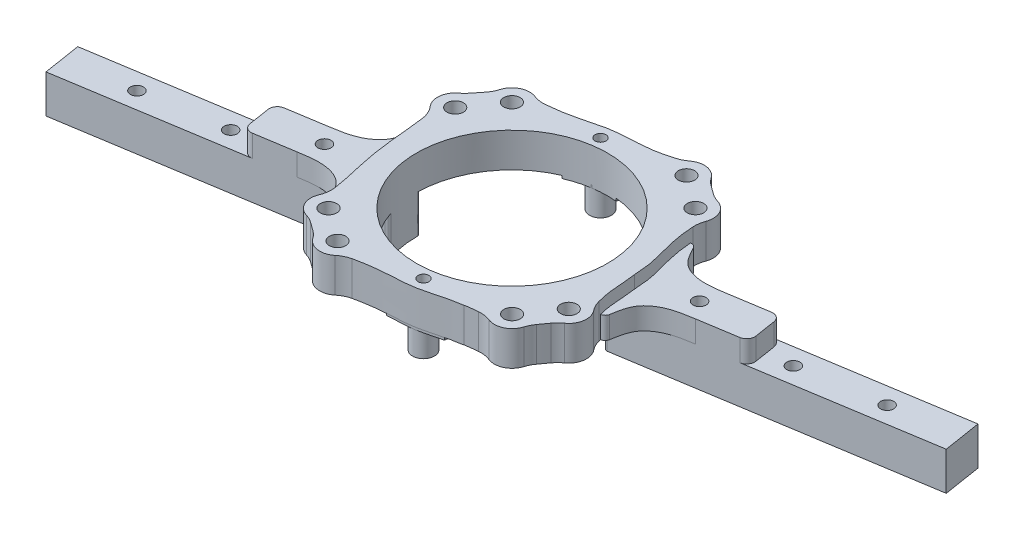
from build123d import *
from build123d.topology import SkipClean

# Parameters (mm, degrees)
SKETCH_1_R           = 18.901009779
SKETCH_1_R_2         = 17.5
EXTRUDE_1_DEPTH      = 2
EXTRUDE_2_DEPTH      = 4.3
EXTRUDE_2_DEPTH_BACK = 2
SKETCH_2_R           = 1.5
SKETCH_2_R_2         = 17.5
SKETCH_3_R           = 2
EXTRUDE_3_DEPTH      = 5
EXTRUDE_START        = 0.5
EXTRUDE_5_DEPTH      = 0.5
EXTRUDE_6_DEPTH      = 4
EXTRUDE_6_2_DEPTH    = 4
EXTRUDE_START_2      = 7
EXTRUDE_7_DEPTH      = 7
SKETCH_8_R           = 1.2
CUT_EXTRUDE_1_DEPTH  = 77.626723178
EXTRUDE_8_REACH      = 77.788
SKETCH_9_R           = 3.25
SKETCH_9_R_2         = 1.5
CHAMFER_1_SIZE       = 1.55
FILLET_1_R           = 5
SKETCH_10_R          = 1
CUT_EXTRUDE_2_DEPTH  = 77.541741014


with BuildPart() as part:
    # 草图1 → 凸台-拉伸1 (new body)
    with BuildSketch(Plane(origin=(0, 0, 0), x_dir=(1, 0, 0), z_dir=(0, 1, 0))):
        with Locations(Location((0, 0, 0), (0, 0, 270))):
            Circle(SKETCH_1_R)
        with Locations(Location((0, 0, 0), (0, 0, 270))):
            Circle(SKETCH_1_R_2, mode=Mode.SUBTRACT)
    extrude(amount=EXTRUDE_1_DEPTH)

    # 草图2 → 凸台-拉伸2 (add, two sides: drawn at the far end of the back side and taken through both)
    with SkipClean():  # the faces are left unmerged after this step: merging them gives an invalid solid
        with BuildSketch(Plane.XZ.offset(-EXTRUDE_2_DEPTH_BACK)):
            with BuildLine():
                add(Edge.make_bspline(
                    [(11.006978072, 19.779596477), (11.311406169, 19.678362683), (14.230678656, 19.324851277), (16.142618358, 19.387861715), (17.812376111, 19.170849796), (19.434426855, 17.903012303), (21.254816538, 15.423586485), (23.04571839, 12.933220341), (23.749453194, 10.988652096), (23.273972045, 8.526140932), (21.973359647, 4.762849234), (22.026869894, 1.187339448), (21.744718502, -0.68301871)],
                    knots=[0, 0, 0, 0, 0.101498159, 0.202996319, 0.236378591, 0.269760863, 0.412659544, 0.555558225, 0.588940497, 0.622322769, 0.811161384, 1, 1, 1, 1], degree=3))
                add(Edge.make_bspline(
                    [(21.744718502, -0.68301871), (21.606804136, -1.5972416), (21.606818458, -3.345206874), (20.687499984, -6.886665409), (19.490680494, -11.303414125), (19.485438038, -15.31229875), (19.177974029, -17.803166562), (17.905645321, -19.433367265), (15.436473595, -21.252764078), (12.97175211, -22.992179816), (11.178329933, -23.690539383), (8.68545531, -23.547333322), (4.923957978, -21.967426346), (0.219151856, -21.812380638), (-3.338613769, -21.566179622), (-6.446285914, -20.810974626), (-9.078517865, -20.090209999), (-12.741232657, -19.484951769), (-15.12467113, -19.373457323), (-17.583926507, -19.24813578), (-19.389543428, -18.099432546), (-21.034805554, -15.407176041), (-24.016641951, -12.402505651), (-22.99271809, -9.588223222), (-22.606234223, -7.221753066), (-22.136984077, -3.989970246), (-21.810453154, 0.69834714), (-20.685937125, 7.889475781), (-19.04388871, 13.127196758), (-19.281571193, 16.828411146)],
                    knots=[0, 0, 0, 0, 0.028864738, 0.055245291, 0.115073348, 0.172417384, 0.182554475, 0.192691566, 0.236085165, 0.279478764, 0.287718731, 0.295958699, 0.357152816, 0.414496852, 0.443361591, 0.469742143, 0.515309065, 0.529597358, 0.586941394, 0.590791521, 0.607068561, 0.65046216, 0.693855759, 0.724941126, 0.73667394, 0.770353047, 0.827697084, 0.885311927, 1, 1, 1, 1], degree=3))
                add(Edge.make_bspline(
                    [(-19.281571193, 16.828411146), (-19.323042686, 17.517404699), (-18.190724849, 19.257777905), (-15.406137347, 21.242075114), (-12.927315161, 23.042140343), (-10.983752987, 23.743052442), (-9.356620096, 23.438697155), (-7.223343127, 22.707726459), (-4.461419185, 22.216236354), (-1.833739023, 21.860725742), (0.773245353, 21.743171245), (3.379401966, 21.57539899), (7.340278666, 20.56622726), (8.685768951, 20.190036227), (9.855791359, 19.993550871), (10.740606379, 19.868175085), (11.006978072, 19.779596477)],
                    knots=[0, 0, 0, 0, 0.047987364, 0.150695814, 0.253405706, 0.277399387, 0.301393069, 0.3743454, 0.44729773, 0.510152409, 0.573007089, 0.641327014, 0.709648134, 0.853023127, 0.882058314, 1, 1, 1, 1], degree=3))
            make_face()
            with Locations(Location((-10.773946649, 21.165646071, 0), (0, 0, 270))):
                Circle(SKETCH_2_R, mode=Mode.SUBTRACT)
            with Locations(Location((16.800393007, 16.787176499, 0), (0, 0, 270))):
                Circle(SKETCH_2_R, mode=Mode.SUBTRACT)
            with Locations(Location((21.165646071, 10.773946649, 0), (0, 0, 270))):
                Circle(SKETCH_2_R, mode=Mode.SUBTRACT)
            with Locations(Location((16.787176499, -16.800393007, 0), (0, 0, 270))):
                Circle(SKETCH_2_R, mode=Mode.SUBTRACT)
            with Locations(Location((10.773946649, -21.165646071, 0), (0, 0, 270))):
                Circle(SKETCH_2_R, mode=Mode.SUBTRACT)
            with Locations(Location((-16.800393007, -16.787176499, 0), (0, 0, 270))):
                Circle(SKETCH_2_R, mode=Mode.SUBTRACT)
            with Locations(Location((-21.165646071, -10.773946649, 0), (0, 0, 270))):
                Circle(SKETCH_2_R, mode=Mode.SUBTRACT)
            with Locations(Location((-16.787176499, 16.800393007, 0), (0, 0, 270))):
                Circle(SKETCH_2_R, mode=Mode.SUBTRACT)
            with Locations(Location((0, 0, 0), (0, 0, 270))):
                Circle(SKETCH_2_R_2, mode=Mode.SUBTRACT)
        extrude(amount=EXTRUDE_2_DEPTH + EXTRUDE_2_DEPTH_BACK)
    add(part.part.scale(1), mode=Mode.REPLACE)  # the faces are merged on a copy

    # 草图3 → 凸台-拉伸3 (add)
    with BuildSketch(Plane.XZ.offset(4.3)):
        with Locations(Location((3.058050496, 19.258720808, 0), (0, 0, 260.976912928))):
            Circle(SKETCH_3_R)
        with Locations(Location((-3.057893673, -19.257733181, 0), (0, 0, 82.69396138))):
            Circle(SKETCH_3_R)
    extrude(amount=EXTRUDE_3_DEPTH)

    # 草图5 → 凸台-拉伸5 (add)
    with BuildSketch(Plane.XZ.offset(4.3).offset(EXTRUDE_START)):
        with BuildLine():
            ThreePointArc((-1.594430891, 17.427214067), (2.744404291, 17.283467392), (6.914353055, 16.076122724))
            ThreePointArc((6.914353055, 16.076122724), (7.916340034, 18.076763633), (7.945397797, 20.314105269))
            add(Edge.make_bspline(
                [(-1.315754635, 21.681493741), (-0.213500532, 21.593909941), (1.380652769, 21.588462702), (3.458508957, 21.39069604), (5.444023573, 20.968355607), (6.916793626, 20.520193328), (7.945397797, 20.314105269)],
                knots=[0, 0, 0, 0, 0.352816808, 0.508742813, 0.665413565, 1, 1, 1, 1], degree=3))
            ThreePointArc((-1.315754635, 21.681493741), (-1.931256666, 19.585544983), (-1.594430891, 17.427214067))
        make_face()
        with BuildLine():
            ThreePointArc((-7.967212551, -20.20747152), (-7.903187563, -18.023954919), (-6.914353055, -16.076122724))
            ThreePointArc((-6.914353055, -16.076122724), (-2.744404291, -17.283467392), (1.594430891, -17.427214067))
            ThreePointArc((1.594430891, -17.427214067), (1.927403897, -19.639830376), (1.261981439, -21.776125043))
            add(Edge.make_bspline(
                [(-7.967212551, -20.20747152), (-6.892044561, -20.465635851), (-5.374615466, -20.95427003), (-3.337701467, -21.409878799), (-1.31902186, -21.62335568), (0.220132249, -21.653450305), (1.261981439, -21.776125043)],
                knots=[0, 0, 0, 0, 0.352816808, 0.508742813, 0.665413565, 1, 1, 1, 1], degree=3))
        make_face()
    extrude(amount=-EXTRUDE_5_DEPTH)



with BuildPart() as body_2:
    # 草图6 → 凸台-拉伸6 (new body)
    with BuildSketch(Plane.XZ.offset(4.3)):
        with BuildLine():
            Line((22.654538263, 6.426378874), (16.713352591, 7.369766858))
            ThreePointArc((16.713352591, 7.369766858), (16.242458448, 7.185723442), (16.172859345, 6.684954795))
            ThreePointArc((16.172859345, 6.684954795), (17.283467392, -2.744404291), (13.306597897, -11.365933856))
            ThreePointArc((13.306597897, -11.365933856), (13.217652847, -11.863630602), (13.608374857, -12.184488177))
            Line((13.608374857, -12.184488177), (19.549560529, -13.127876161))
            ThreePointArc((19.549560529, -13.127876161), (20.156446743, -13.033246203), (20.593539579, -12.601719196))
            add(Edge.make_bspline(
                [(20.593539579, -12.601719196), (20.816495808, -12.173095331), (21.417106909, -11.005868705), (22.86029248, -8.968472404), (26.518823134, -7.757459124), (29.195579008, -8.177716446), (30.909405061, -8.449851167)],
                knots=[0.057025884, 0.057025884, 0.057025884, 0.057025884, 0.16943521, 0.360280245, 0.616457111, 1, 1, 1, 1], degree=3))
            Line((30.909405061, -8.449851167), (37.950863688, -9.567949106))
            ThreePointArc((37.950863688, -9.567949106), (39.067298637, -9.300381376), (39.667538403, -8.321743697))
            Line((39.667538403, -8.321743697), (39.980869378, -6.348475511))
            Line((39.980869378, -6.348475511), (40.294200352, -4.375207324))
            ThreePointArc((40.294200352, -4.375207324), (40.026632623, -3.258772376), (39.047994944, -2.658532609))
            Line((39.047994944, -2.658532609), (32.006536317, -1.54043467))
            add(Edge.make_bspline(
                [(23.48418194, 5.602713421), (23.563398798, 5.126108148), (23.772901273, 3.830245344), (24.5139861, 1.446013486), (27.617434738, -0.838719816), (30.292710264, -1.268299949), (32.006536317, -1.54043467)],
                knots=[0.057025884, 0.057025884, 0.057025884, 0.057025884, 0.16943521, 0.360280245, 0.616457111, 1, 1, 1, 1], degree=3))
            ThreePointArc((23.48418194, 5.602713421), (23.202260499, 6.148411145), (22.654538263, 6.426378874))
        make_face()
    extrude(amount=-EXTRUDE_6_DEPTH)


with BuildPart() as body_3:
    # 草图6 → Extrude 6 2 (new body)
    with BuildSketch(Plane.XZ.offset(4.3)):
        with BuildLine():
            Line((-30.909405061, 8.449851167), (-37.950863688, 9.567949106))
            ThreePointArc((-37.950863688, 9.567949106), (-39.067298637, 9.300381376), (-39.667538403, 8.321743697))
            Line((-39.667538403, 8.321743697), (-39.980869378, 6.348475511))
            Line((-39.980869378, 6.348475511), (-40.294200352, 4.375207324))
            ThreePointArc((-40.294200352, 4.375207324), (-40.026632623, 3.258772376), (-39.047994944, 2.658532609))
            Line((-39.047994944, 2.658532609), (-32.006536317, 1.54043467))
            add(Edge.make_bspline(
                [(-23.48418194, -5.602713421), (-23.563398798, -5.126108148), (-23.772901273, -3.830245344), (-24.5139861, -1.446013486), (-27.617434738, 0.838719816), (-30.292710264, 1.268299949), (-32.006536317, 1.54043467)],
                knots=[0.057025884, 0.057025884, 0.057025884, 0.057025884, 0.16943521, 0.360280245, 0.616457111, 1, 1, 1, 1], degree=3))
            ThreePointArc((-23.48418194, -5.602713421), (-23.239946803, -6.186370979), (-22.654538263, -6.426378874))
            Line((-22.654538263, -6.426378874), (-16.713352591, -7.369766858))
            ThreePointArc((-16.713352591, -7.369766858), (-16.242458448, -7.185723442), (-16.172859345, -6.684954795))
            ThreePointArc((-16.172859345, -6.684954795), (-17.283467392, 2.744404291), (-13.306597897, 11.365933856))
            ThreePointArc((-13.306597897, 11.365933856), (-13.217652847, 11.863630602), (-13.608374857, 12.184488177))
            Line((-13.608374857, 12.184488177), (-19.549560529, 13.127876161))
            ThreePointArc((-19.549560529, 13.127876161), (-20.156446743, 13.033246203), (-20.593539579, 12.601719196))
            add(Edge.make_bspline(
                [(-20.593539579, 12.601719196), (-20.816495808, 12.173095331), (-21.417106909, 11.005868705), (-22.86029248, 8.968472404), (-26.518823134, 7.757459124), (-29.195579008, 8.177716446), (-30.909405061, 8.449851167)],
                knots=[0.057025884, 0.057025884, 0.057025884, 0.057025884, 0.16943521, 0.360280245, 0.616457111, 1, 1, 1, 1], degree=3))
        make_face()
    extrude(amount=-EXTRUDE_6_2_DEPTH)


with BuildPart() as part_1:
    add(part.part)

    add(body_2.part)  # 凸台-拉伸7 merges body 2

    add(body_3.part)  # 凸台-拉伸7 merges body 3
    # 草图7 → 凸台-拉伸7 (add)
    with BuildSketch(Plane.XZ.offset(4.3).offset(EXTRUDE_START_2)):
        with BuildLine():
            Line((17.228715118, -6.277524091), (70.560557356, -14.745971617))
            Line((70.560557356, -14.745971617), (71.657688612, -7.83655512))
            Line((71.657688612, -7.83655512), (18.325846374, 0.631892406))
            Line((18.325846374, 0.631892406), (18.077536281, 0.671321027))
            ThreePointArc((18.077536281, 0.671321027), (17.672604431, 0.556169125), (17.499149043, 0.172576905))
            ThreePointArc((17.499149043, 0.172576905), (17.283467392, -2.744404291), (16.58496056, -5.584718724))
            ThreePointArc((16.58496056, -5.584718724), (16.631060618, -6.003173677), (16.980405025, -6.23809547))
            Line((16.980405025, -6.23809547), (17.228715118, -6.277524091))
        make_face()
        with BuildLine():
            Line((-71.657688612, 7.83655512), (-70.560557356, 14.745971617))
            Line((-70.560557356, 14.745971617), (-17.228715118, 6.277524091))
            Line((-17.228715118, 6.277524091), (-16.980405025, 6.23809547))
            ThreePointArc((-16.980405025, 6.23809547), (-16.631060618, 6.003173677), (-16.58496056, 5.584718724))
            ThreePointArc((-16.58496056, 5.584718724), (-17.283467392, 2.744404291), (-17.499149043, -0.172576905))
            ThreePointArc((-17.499149043, -0.172576905), (-17.672604431, -0.556169125), (-18.077536281, -0.671321027))
            Line((-18.077536281, -0.671321027), (-18.325846374, -0.631892406))
            Line((-18.325846374, -0.631892406), (-71.657688612, 7.83655512))
        make_face()
    extrude(amount=-EXTRUDE_7_DEPTH)

    # 草图8 → 切除-拉伸1 (cut, through all)
    with BuildSketch(Plane.XZ.offset(11.3)):
        with Locations(Location((59.257602487, -9.409386141, 0), (0, 0, 270))):
            Circle(SKETCH_8_R)
        with Locations(Location((44.443201865, -7.057039605, 0), (0, 0, 270))):
            Circle(SKETCH_8_R)
        with Locations(Location((29.628801243, -4.70469307, 0), (0, 0, 270))):
            Circle(SKETCH_8_R)
        with Locations(Location((-29.628801243, 4.70469307, 0), (0, 0, 270))):
            Circle(SKETCH_8_R)
        with Locations(Location((-44.443201865, 7.057039605, 0), (0, 0, 270))):
            Circle(SKETCH_8_R)
        with Locations(Location((-59.257602487, 9.409386141, 0), (0, 0, 270))):
            Circle(SKETCH_8_R)
    extrude(amount=-CUT_EXTRUDE_1_DEPTH, mode=Mode.SUBTRACT)

    # 凸台-拉伸8: up to this face of the body (flat: up to its plane)
    extrude_8_end = Plane(part_1.part.faces().sort_by_distance((0, 2, -18.366408492))[0])
    # 草图9 → 凸台-拉伸8 (add, up to the picked face)
    with BuildSketch(Plane.XZ.offset(4.3), mode=Mode.PRIVATE) as extrude_8_sk1:
        with Locations((16.800393007, 16.787176499)):
            Circle(SKETCH_9_R)
        with Locations(Location((16.800393007, 16.787176499, 0), (0, 0, 270))):
            Circle(SKETCH_9_R_2, mode=Mode.SUBTRACT)
    extrude_8_tool1 = split(extrude(extrude_8_sk1.sketch, amount=-EXTRUDE_8_REACH, mode=Mode.PRIVATE), bisect_by=extrude_8_end, keep=Keep.BOTH, mode=Mode.PRIVATE)
    # 草图9 → 凸台-拉伸8 (add, up to the picked face)
    with BuildSketch(Plane.XZ.offset(4.3), mode=Mode.PRIVATE) as extrude_8_sk2:
        with Locations((21.165646071, 10.773946649)):
            Circle(SKETCH_9_R)
        with Locations(Location((21.165646071, 10.773946649, 0), (0, 0, 270))):
            Circle(SKETCH_9_R_2, mode=Mode.SUBTRACT)
    extrude_8_tool2 = split(extrude(extrude_8_sk2.sketch, amount=-EXTRUDE_8_REACH, mode=Mode.PRIVATE), bisect_by=extrude_8_end, keep=Keep.BOTH, mode=Mode.PRIVATE)
    # 草图9 → 凸台-拉伸8 (add, up to the picked face)
    with BuildSketch(Plane.XZ.offset(4.3), mode=Mode.PRIVATE) as extrude_8_sk3:
        with Locations((16.787176499, -16.800393007)):
            Circle(SKETCH_9_R)
        with Locations(Location((16.787176499, -16.800393007, 0), (0, 0, 270))):
            Circle(SKETCH_9_R_2, mode=Mode.SUBTRACT)
    extrude_8_tool3 = split(extrude(extrude_8_sk3.sketch, amount=-EXTRUDE_8_REACH, mode=Mode.PRIVATE), bisect_by=extrude_8_end, keep=Keep.BOTH, mode=Mode.PRIVATE)
    # 草图9 → 凸台-拉伸8 (add, up to the picked face)
    with BuildSketch(Plane.XZ.offset(4.3), mode=Mode.PRIVATE) as extrude_8_sk4:
        with Locations((10.773946649, -21.165646071)):
            Circle(SKETCH_9_R)
        with Locations(Location((10.773946649, -21.165646071, 0), (0, 0, 270))):
            Circle(SKETCH_9_R_2, mode=Mode.SUBTRACT)
    extrude_8_tool4 = split(extrude(extrude_8_sk4.sketch, amount=-EXTRUDE_8_REACH, mode=Mode.PRIVATE), bisect_by=extrude_8_end, keep=Keep.BOTH, mode=Mode.PRIVATE)
    # 草图9 → 凸台-拉伸8 (add, up to the picked face)
    with BuildSketch(Plane.XZ.offset(4.3), mode=Mode.PRIVATE) as extrude_8_sk5:
        with Locations((-16.800393007, -16.787176499)):
            Circle(SKETCH_9_R)
        with Locations(Location((-16.800393007, -16.787176499, 0), (0, 0, 270))):
            Circle(SKETCH_9_R_2, mode=Mode.SUBTRACT)
    extrude_8_tool5 = split(extrude(extrude_8_sk5.sketch, amount=-EXTRUDE_8_REACH, mode=Mode.PRIVATE), bisect_by=extrude_8_end, keep=Keep.BOTH, mode=Mode.PRIVATE)
    # 草图9 → 凸台-拉伸8 (add, up to the picked face)
    with BuildSketch(Plane.XZ.offset(4.3), mode=Mode.PRIVATE) as extrude_8_sk6:
        with Locations((-21.165646071, -10.773946649)):
            Circle(SKETCH_9_R)
        with Locations(Location((-21.165646071, -10.773946649, 0), (0, 0, 270))):
            Circle(SKETCH_9_R_2, mode=Mode.SUBTRACT)
    extrude_8_tool6 = split(extrude(extrude_8_sk6.sketch, amount=-EXTRUDE_8_REACH, mode=Mode.PRIVATE), bisect_by=extrude_8_end, keep=Keep.BOTH, mode=Mode.PRIVATE)
    # 草图9 → 凸台-拉伸8 (add, up to the picked face)
    with BuildSketch(Plane.XZ.offset(4.3), mode=Mode.PRIVATE) as extrude_8_sk7:
        with Locations((-10.773946649, 21.165646071)):
            Circle(SKETCH_9_R)
        with Locations(Location((-10.773946649, 21.165646071, 0), (0, 0, 270))):
            Circle(SKETCH_9_R_2, mode=Mode.SUBTRACT)
    extrude_8_tool7 = split(extrude(extrude_8_sk7.sketch, amount=-EXTRUDE_8_REACH, mode=Mode.PRIVATE), bisect_by=extrude_8_end, keep=Keep.BOTH, mode=Mode.PRIVATE)
    # 草图9 → 凸台-拉伸8 (add, up to the picked face)
    with BuildSketch(Plane.XZ.offset(4.3), mode=Mode.PRIVATE) as extrude_8_sk8:
        with Locations((-16.787176499, 16.800393007)):
            Circle(SKETCH_9_R)
        with Locations(Location((-16.787176499, 16.800393007, 0), (0, 0, 270))):
            Circle(SKETCH_9_R_2, mode=Mode.SUBTRACT)
    extrude_8_tool8 = split(extrude(extrude_8_sk8.sketch, amount=-EXTRUDE_8_REACH, mode=Mode.PRIVATE), bisect_by=extrude_8_end, keep=Keep.BOTH, mode=Mode.PRIVATE)
    add(extrude_8_tool1.solids().sort_by(Axis((13.642317, -4.3, 16.787176), (0, 1, 0)))[0])
    add(extrude_8_tool2.solids().sort_by(Axis((18.00757, -4.3, 10.773947), (0, 1, 0)))[0])
    add(extrude_8_tool3.solids().sort_by(Axis((13.6291, -4.3, -16.800393), (0, 1, 0)))[0])
    add(extrude_8_tool4.solids().sort_by(Axis((7.615871, -4.3, -21.165646), (0, 1, 0)))[0])
    add(extrude_8_tool5.solids().sort_by(Axis((-19.958469, -4.3, -16.787176), (0, 1, 0)))[0])
    add(extrude_8_tool6.solids().sort_by(Axis((-24.323722, -4.3, -10.773947), (0, 1, 0)))[0])
    add(extrude_8_tool7.solids().sort_by(Axis((-13.932023, -4.3, 21.165646), (0, 1, 0)))[0])
    add(extrude_8_tool8.solids().sort_by(Axis((-19.945253, -4.3, 16.800393), (0, 1, 0)))[0])

    # 倒角1
    chamfer_1_edges = [part_1.edges().sort_by_distance(p)[0] for p in [
        (-10.773946649, -4.3, 22.665646071),
        (16.800393007, -4.3, 18.287176499),
        (21.165646071, -4.3, 12.273946649),
        (16.787176499, -4.3, -15.300393006),
        (10.773946649, -4.3, -19.665646071),
        (-16.800393007, -4.3, -15.287176499),
        (-21.165646071, -4.3, -9.273946649),
        (-16.787176499, -4.3, 18.300393007),
    ]]
    chamfer(chamfer_1_edges, length=CHAMFER_1_SIZE)

    # 圆角1
    # the kernel refuses this fillet: 5 mm, written as the material it adds along each edge
    with BuildSketch(Plane(origin=(17.01728543, -4.3, -20.0422366), x_dir=(-0.7897948679035182, 0, -0.6133710676525785), z_dir=(0, 1, 0))) as fillet_1_piece_1:
        with BuildLine():
            CenterArc((1.153687342, -4.999019805), FILLET_1_R, 91.134529766, 19.894232121)
            Line((-0.640495419, -0.332017746), (-0.676379074, -0.238677705))
            ThreePointArc((-0.676379074, -0.238677705), (-0.35702826, -0.095055515), (-0.055591207, 0.083124111))
            Line((-0.055591207, 0.083124111), (0.002450592, 0.099969968))
            ThreePointArc((0.002450592, 0.099969968), (0.527232826, 0.094158012), (1.052707413, 0.099980396))
            Line((1.052707413, 0.099980396), (1.054687412, 0))
        make_face()
    extrude(amount=4.3)
    with BuildSketch(Plane(origin=(19.442584228, -4.3, -14.926544081), x_dir=(0.060465184712166754, 0, 0.9981703068303143), z_dir=(0, 1, 0))) as fillet_1_piece_2:
        with BuildLine():
            CenterArc((1.323560232, 4.999965115), FILLET_1_R, 246.007883205, 24.206144362)
            Line((-0.7094945, 0.43195806), (-0.750155595, 0.340597919))
            ThreePointArc((-0.750155595, 0.340597919), (-0.392893069, 0.153324224), (-0.062491695, -0.078069124))
            Line((-0.062491695, -0.078069124), (0.000100504, -0.099999949))
            ThreePointArc((0.000100504, -0.099999949), (0.670999725, -0.100454155), (1.342611165, -0.099999302))
            Line((1.342611165, -0.099999302), (1.342237618, 0))
        make_face()
    extrude(amount=4.3)
    with BuildSketch(Plane(origin=(8.268099537, -4.3, -23.235242711), x_dir=(0.7212658173988827, 0, -0.6926583722528167), z_dir=(0, 1, 0))) as fillet_1_piece_3:
        with BuildLine():
            CenterArc((1.32288366, 4.966808144), FILLET_1_R, 242.302269419, 21.092181275)
            Line((-1.00115122, 0.53974796), (-1.047631917, 0.451206756))
            ThreePointArc((-1.047631917, 0.451206756), (-0.545986583, 0.185326784), (-0.04897138, -0.087188325))
            Line((-0.04897138, -0.087188325), (0.011503336, -0.099336163))
            ThreePointArc((0.011503336, -0.099336163), (0.373858426, -0.078425294), (0.736213515, -0.099336163))
            Line((0.736213515, -0.099336163), (0.747716851, 0))
        make_face()
    extrude(amount=4.3)
    with BuildSketch(Plane(origin=(13.791530953, -4.3, -22.372578119), x_dir=(0.8295913675124091, 0, 0.5583709904256228), z_dir=(0, 1, 0))) as fillet_1_piece_4:
        with BuildLine():
            CenterArc((1.170209685, 4.99915551), FILLET_1_R, 248.678880349, 20.268052642)
            Line((-0.647763486, 0.341369174), (-0.684122949, 0.248213447))
            ThreePointArc((-0.684122949, 0.248213447), (-0.36085925, 0.100518091), (-0.056290648, -0.08265206))
            Line((-0.056290648, -0.08265206), (0.002285828, -0.099973872))
            ThreePointArc((0.002285828, -0.099973872), (0.539052874, -0.094441722), (1.07647958, -0.09998311))
            Line((1.07647958, -0.09998311), (1.078317426, 0))
        make_face()
    extrude(amount=4.3)
    with BuildSketch(Plane(origin=(-20.044363192, -4.3, -16.98505889), x_dir=(0.17091997531939457, 0, -0.9852849141425122), z_dir=(0, 1, 0))) as fillet_1_piece_5:
        with BuildLine():
            CenterArc((1.272037185, 4.969318367), FILLET_1_R, 242.892101832, 20.757306375)
            Line((-1.006300905, 0.518568368), (-1.051867666, 0.429553368))
            ThreePointArc((-1.051867666, 0.429553368), (-0.547599084, 0.172400858), (-0.047091474, -0.088217873))
            Line((-0.047091474, -0.088217873), (0.011061193, -0.099386367))
            ThreePointArc((0.011061193, -0.099386367), (0.35948877, -0.080056938), (0.707916346, -0.099386367))
            Line((0.707916346, -0.099386367), (0.718977539, 0))
        make_face()
    extrude(amount=4.3)
    with BuildSketch(Plane(origin=(-14.856975008, -4.3, -19.392100007), x_dir=(0.9974581030876246, 0, -0.07125540389919639), z_dir=(0, 1, 0))) as fillet_1_piece_6:
        with BuildLine():
            CenterArc((1.400111301, 4.999566003), FILLET_1_R, 244.711507988, 26.04340849)
            Line((-0.735770037, 0.478724167), (-0.778487664, 0.388307331))
            ThreePointArc((-0.778487664, 0.388307331), (-0.406184929, 0.180497442), (-0.065356705, -0.075686862))
            Line((-0.065356705, -0.075686862), (-0.001079625, -0.099994172))
            ThreePointArc((-0.001079625, -0.099994172), (0.73293203, -0.104392673), (1.467305825, -0.09999132))
            Line((1.467305825, -0.09999132), (1.465988286, 0))
        make_face()
    extrude(amount=4.3)
    with BuildSketch(Plane(origin=(-22.722035069, -4.3, -7.920851261), x_dir=(0.1474806796655983, 0, 0.9890649367586403), z_dir=(0, 1, 0))) as fillet_1_piece_7:
        with BuildLine():
            CenterArc((1.837439731, -4.999694321), FILLET_1_R, 89.366440476, 33.109495346)
            Line((-0.847286955, -0.781609137), (-0.900981489, -0.697247434))
            ThreePointArc((-0.900981489, -0.697247434), (-0.456517609, -0.355168058), (-0.079764902, 0.060312192))
            Line((-0.079764902, 0.060312192), (-0.000945118, 0.099995534))
            ThreePointArc((-0.000945118, 0.099995534), (0.946320946, 0.104845913), (1.89383285, 0.099993886))
            Line((1.89383285, 0.099993886), (1.892727103, 0))
        make_face()
    extrude(amount=4.3)
    with BuildSketch(Plane(origin=(-22.622821712, -4.3, -13.678966296), x_dir=(0.5999888062013635, 0, -0.8000083952266143), z_dir=(0, 1, 0))) as fillet_1_piece_8:
        with BuildLine():
            CenterArc((0.905648234, 4.997885104), FILLET_1_R, 253.411085847, 14.922386992)
            Line((-0.521866473, 0.20599594), (-0.550416768, 0.110158157))
            ThreePointArc((-0.550416768, 0.110158157), (-0.293195798, 0.021264569), (-0.044607724, -0.089499447))
            Line((-0.044607724, -0.089499447), (0.003758023, -0.099929361))
            ThreePointArc((0.003758023, -0.099929361), (0.37991965, -0.09369041), (0.757328581, -0.099957702))
            Line((0.757328581, -0.099957702), (0.760236809, 0))
        make_face()
    extrude(amount=4.3)
    with BuildSketch(Plane(origin=(-19.280081709, -4.3, 14.715225481), x_dir=(-0.09946102204581701, 0, -0.9950414589822885), z_dir=(0, 1, 0))) as fillet_1_piece_9:
        with BuildLine():
            CenterArc((1.57781456, 4.996505023), FILLET_1_R, 241.78387735, 30.358520278)
            Line((-0.786179136, 0.5906528), (-0.833459009, 0.502535756))
            ThreePointArc((-0.833459009, 0.502535756), (-0.430687698, 0.245281999), (-0.071470001, -0.069943112))
            Line((-0.071470001, -0.069943112), (-0.004132943, -0.099914557))
            ThreePointArc((-0.004132943, -0.099914557), (0.882481416, -0.117382198), (1.768468777, -0.0999301))
            Line((1.768468777, -0.0999301), (1.764730459, 0))
        make_face()
    extrude(amount=4.3)
    with BuildSketch(Plane(origin=(-17.02234811, -4.3, 20.041873272), x_dir=(0.7927990464256166, 0, 0.6094831187052131), z_dir=(0, 1, 0))) as fillet_1_piece_10:
        with BuildLine():
            CenterArc((1.140743792, -4.999024164), FILLET_1_R, 91.132004572, 19.670187226)
            Line((-0.634969823, -0.324963707), (-0.670484095, -0.231482497))
            ThreePointArc((-0.670484095, -0.231482497), (-0.354100914, -0.090935227), (-0.055051805, 0.083482326))
            Line((-0.055051805, 0.083482326), (0.002537198, 0.099967808))
            ThreePointArc((0.002537198, 0.099967808), (0.52084987, 0.094124067), (1.039988592, 0.099980483))
            Line((1.039988592, 0.099980483), (1.041964184, 0))
        make_face()
    extrude(amount=4.3)
    with BuildSketch(Plane(origin=(-8.114164869, -4.3, 23.033281176), x_dir=(-0.6779346561232752, 0, 0.7351221680965802), z_dir=(0, 1, 0))) as fillet_1_piece_11:
        with BuildLine():
            CenterArc((1.522310831, 4.955998632), FILLET_1_R, 235.458414677, 26.934737595)
            Line((-1.312710365, 0.837424265), (-1.369410789, 0.755052778))
            ThreePointArc((-1.369410789, 0.755052778), (-0.716668783, 0.323522888), (-0.05165497, -0.085625721))
            Line((-0.05165497, -0.085625721), (0.013237485, -0.099119973))
            ThreePointArc((0.013237485, -0.099119973), (0.430218278, -0.071399111), (0.847199071, -0.099119973))
            Line((0.847199071, -0.099119973), (0.860436556, 0))
        make_face()
    extrude(amount=4.3)
    with BuildSketch(Plane(origin=(-13.791655716, -4.3, 22.372266137), x_dir=(0.4728074638380271, 0, 0.8811657631450809), z_dir=(0, 1, 0))) as fillet_1_piece_12:
        with BuildLine():
            CenterArc((1.286453976, -4.968616749), FILLET_1_R, 96.422868303, 20.166093465)
            Line((-0.951480112, -0.497414336), (-0.996238794, -0.407990287))
            ThreePointArc((-0.996238794, -0.407990287), (-0.51942777, -0.164863957), (-0.048357358, 0.087530372))
            Line((-0.048357358, 0.087530372), (0.011186556, 0.099372335))
            ThreePointArc((0.011186556, 0.099372335), (0.36356308, 0.079600887), (0.715939604, 0.099372335))
            Line((0.715939604, 0.099372335), (0.72712616, 0))
        make_face()
    extrude(amount=4.3)
    with BuildSketch(Plane(origin=(20.042459715, -4.3, 17.01412024), x_dir=(0.6137735703285745, 0, -0.789482111492157), z_dir=(0, 1, 0))) as fillet_1_piece_13:
        with BuildLine():
            CenterArc((1.156438702, -4.999103901), FILLET_1_R, 91.08476861, 19.994329031)
            Line((-0.641843442, -0.333679876), (-0.677809085, -0.240371396))
            ThreePointArc((-0.677809085, -0.240371396), (-0.357735522, -0.096027467), (-0.055714672, 0.083041407))
            Line((-0.055714672, 0.083041407), (0.002380915, 0.099971652))
            ThreePointArc((0.002380915, 0.099971652), (0.530775114, 0.094327186), (1.059887273, 0.099982078))
            Line((1.059887273, 0.099982078), (1.061780438, 0))
        make_face()
    extrude(amount=4.3)
    with BuildSketch(Plane(origin=(14.843051209, -4.3, 19.38165392), x_dir=(-0.9982493015875555, 0, 0.05914669796326535), z_dir=(0, 1, 0))) as fillet_1_piece_14:
        with BuildLine():
            CenterArc((1.389204936, 4.998215156), FILLET_1_R, 244.923545447, 26.607421175)
            Line((-0.729931301, 0.469499929), (-0.772314026, 0.378925624))
            ThreePointArc((-0.772314026, 0.378925624), (-0.403319938, 0.175120573), (-0.064842149, -0.076128153))
            Line((-0.064842149, -0.076128153), (-0.002485399, -0.099969109))
            ThreePointArc((-0.002485399, -0.099969109), (0.761332938, -0.110575978), (1.525462803, -0.099964303))
            Line((1.525462803, -0.099964303), (1.52279108, 0))
        make_face()
    extrude(amount=4.3)
    with BuildSketch(Plane(origin=(23.095798962, -4.3, 8.159179007), x_dir=(-0.2567353815947337, 0, -0.9664817348700422), z_dir=(0, 1, 0))) as fillet_1_piece_15:
        with BuildLine():
            CenterArc((1.324251503, -4.999873011), FILLET_1_R, 89.591646086, 24.410336772)
            Line((-0.709589788, -0.432216106), (-0.750266614, -0.340862968))
            ThreePointArc((-0.750266614, -0.340862968), (-0.39294637, -0.153472956), (-0.062510358, 0.078054181))
            Line((-0.062510358, 0.078054181), (-0.000103427, 0.099999947))
            ThreePointArc((-0.000103427, 0.099999947), (0.679789024, 0.101379465), (1.360599509, 0.09999746))
            Line((1.360599509, 0.09999746), (1.359886803, 0))
        make_face()
    extrude(amount=4.3)
    with BuildSketch(Plane(origin=(22.388417322, -4.3, 13.785147483), x_dir=(-0.5609994783342959, 0, 0.8278161542931182), z_dir=(0, 1, 0))) as fillet_1_piece_16:
        with BuildLine():
            CenterArc((1.153537899, 4.999086482), FILLET_1_R, 248.972108606, 19.932630173)
            Line((-0.640573956, 0.332057165), (-0.676456193, 0.238716578))
            ThreePointArc((-0.676456193, 0.238716578), (-0.357065157, 0.095079522), (-0.055592205, -0.083123443))
            Line((-0.055592205, -0.083123443), (0.002402316, -0.09997114))
            ThreePointArc((0.002402316, -0.09997114), (0.528866262, -0.094294467), (1.056052673, -0.09998173))
            Line((1.056052673, -0.09998173), (1.057964148, 0))
        make_face()
    extrude(amount=4.3)
    with BuildSketch(Plane(origin=(22.388417322, 2, 13.785147483), x_dir=(-0.5609994783342943, 0, 0.8278161542931193), z_dir=(0, -1, 0))) as fillet_1_piece_17:
        with BuildLine():
            CenterArc((1.153537899, -4.999086482), FILLET_1_R, 91.095261221, 19.932630173)
            Line((-0.640573956, -0.332057165), (-0.676456193, -0.238716578))
            ThreePointArc((-0.676456193, -0.238716578), (-0.357065157, -0.095079522), (-0.055592205, 0.083123443))
            Line((-0.055592205, 0.083123443), (0.002402316, 0.09997114))
            ThreePointArc((0.002402316, 0.09997114), (0.528866262, 0.094294467), (1.056052673, 0.09998173))
            Line((1.056052673, 0.09998173), (1.057964148, 0))
        make_face()
    extrude(amount=2.0000006)
    with BuildSketch(Plane(origin=(23.095798962, 2, 8.159179007), x_dir=(-0.25673538159473436, 0, -0.966481734870042), z_dir=(0, -1, 0))) as fillet_1_piece_18:
        with BuildLine():
            CenterArc((1.324251503, 4.999873011), FILLET_1_R, 245.998017142, 24.410336772)
            Line((-0.709589788, 0.432216106), (-0.750266614, 0.340862968))
            ThreePointArc((-0.750266614, 0.340862968), (-0.39294637, 0.153472956), (-0.062510358, -0.078054181))
            Line((-0.062510358, -0.078054181), (-0.000103427, -0.099999947))
            ThreePointArc((-0.000103427, -0.099999947), (0.679789024, -0.101379465), (1.360599509, -0.09999746))
            Line((1.360599509, -0.09999746), (1.359886803, 0))
        make_face()
    extrude(amount=2.0000006)
    with BuildSketch(Plane(origin=(14.843051209, 2, 19.38165392), x_dir=(-0.9982493015875555, 0, 0.059146697963265625), z_dir=(0, -1, 0))) as fillet_1_piece_19:
        with BuildLine():
            CenterArc((1.389204936, -4.998215156), FILLET_1_R, 88.469033378, 26.607421175)
            Line((-0.729931301, -0.469499929), (-0.772314026, -0.378925624))
            ThreePointArc((-0.772314026, -0.378925624), (-0.403319938, -0.175120573), (-0.064842149, 0.076128153))
            Line((-0.064842149, 0.076128153), (-0.002485399, 0.099969109))
            ThreePointArc((-0.002485399, 0.099969109), (0.761332938, 0.110575978), (1.525462803, 0.099964303))
            Line((1.525462803, 0.099964303), (1.52279108, 0))
        make_face()
    extrude(amount=2.0000006)
    with BuildSketch(Plane(origin=(20.042459715, 2, 17.01412024), x_dir=(0.6137735703285737, 0, -0.7894821114921574), z_dir=(0, -1, 0))) as fillet_1_piece_20:
        with BuildLine():
            CenterArc((1.156438702, 4.999103901), FILLET_1_R, 248.920902358, 19.994329031)
            Line((-0.641843442, 0.333679876), (-0.677809085, 0.240371396))
            ThreePointArc((-0.677809085, 0.240371396), (-0.357735522, 0.096027467), (-0.055714672, -0.083041407))
            Line((-0.055714672, -0.083041407), (0.002380915, -0.099971652))
            ThreePointArc((0.002380915, -0.099971652), (0.530775114, -0.094327186), (1.059887273, -0.099982078))
            Line((1.059887273, -0.099982078), (1.061780438, 0))
        make_face()
    extrude(amount=2.0000006)
    with BuildSketch(Plane(origin=(-13.791655716, 2, 22.372266137), x_dir=(0.4728074638380253, 0, 0.8811657631450818), z_dir=(0, -1, 0))) as fillet_1_piece_21:
        with BuildLine():
            CenterArc((1.286453976, 4.968616749), FILLET_1_R, 243.411038232, 20.166093465)
            Line((-0.951480112, 0.497414336), (-0.996238794, 0.407990287))
            ThreePointArc((-0.996238794, 0.407990287), (-0.51942777, 0.164863957), (-0.048357358, -0.087530372))
            Line((-0.048357358, -0.087530372), (0.011186556, -0.099372335))
            ThreePointArc((0.011186556, -0.099372335), (0.36356308, -0.079600887), (0.715939604, -0.099372335))
            Line((0.715939604, -0.099372335), (0.72712616, 0))
        make_face()
    extrude(amount=2.0000006)
    with BuildSketch(Plane(origin=(-8.114164869, 2, 23.033281176), x_dir=(-0.6779346561232753, 0, 0.7351221680965799), z_dir=(0, -1, 0))) as fillet_1_piece_22:
        with BuildLine():
            CenterArc((1.522310831, -4.955998632), FILLET_1_R, 97.606847728, 26.934737595)
            Line((-1.312710365, -0.837424265), (-1.369410789, -0.755052778))
            ThreePointArc((-1.369410789, -0.755052778), (-0.716668783, -0.323522888), (-0.05165497, 0.085625721))
            Line((-0.05165497, 0.085625721), (0.013237485, 0.099119973))
            ThreePointArc((0.013237485, 0.099119973), (0.430218278, 0.071399111), (0.847199071, 0.099119973))
            Line((0.847199071, 0.099119973), (0.860436556, 0))
        make_face()
    extrude(amount=2.0000006)
    with BuildSketch(Plane(origin=(-17.02234811, 2, 20.041873272), x_dir=(0.792799046425617, 0, 0.6094831187052127), z_dir=(0, -1, 0))) as fillet_1_piece_23:
        with BuildLine():
            CenterArc((1.140743792, 4.999024164), FILLET_1_R, 249.197808202, 19.670187226)
            Line((-0.634969823, 0.324963707), (-0.670484095, 0.231482497))
            ThreePointArc((-0.670484095, 0.231482497), (-0.354100914, 0.090935227), (-0.055051805, -0.083482326))
            Line((-0.055051805, -0.083482326), (0.002537198, -0.099967808))
            ThreePointArc((0.002537198, -0.099967808), (0.52084987, -0.094124067), (1.039988592, -0.099980483))
            Line((1.039988592, -0.099980483), (1.041964184, 0))
        make_face()
    extrude(amount=2.0000006)
    with BuildSketch(Plane(origin=(-19.280081709, 2, 14.715225481), x_dir=(-0.09946102204581761, 0, -0.9950414589822885), z_dir=(0, -1, 0))) as fillet_1_piece_24:
        with BuildLine():
            CenterArc((1.57781456, -4.996505023), FILLET_1_R, 87.857602373, 30.358520278)
            Line((-0.786179136, -0.5906528), (-0.833459009, -0.502535756))
            ThreePointArc((-0.833459009, -0.502535756), (-0.430687698, -0.245281999), (-0.071470001, 0.069943112))
            Line((-0.071470001, 0.069943112), (-0.004132943, 0.099914557))
            ThreePointArc((-0.004132943, 0.099914557), (0.882481416, 0.117382198), (1.768468777, 0.0999301))
            Line((1.768468777, 0.0999301), (1.764730459, 0))
        make_face()
    extrude(amount=2.0000006)
    with BuildSketch(Plane(origin=(-22.622821712, 2, -13.678966296), x_dir=(0.5999888062013642, 0, -0.8000083952266137), z_dir=(0, -1, 0))) as fillet_1_piece_25:
        with BuildLine():
            CenterArc((0.905648234, -4.997885104), FILLET_1_R, 91.666527161, 14.922386992)
            Line((-0.521866473, -0.20599594), (-0.550416768, -0.110158157))
            ThreePointArc((-0.550416768, -0.110158157), (-0.293195798, -0.021264569), (-0.044607724, 0.089499447))
            Line((-0.044607724, 0.089499447), (0.003758023, 0.099929361))
            ThreePointArc((0.003758023, 0.099929361), (0.37991965, 0.09369041), (0.757328581, 0.099957702))
            Line((0.757328581, 0.099957702), (0.760236809, 0))
        make_face()
    extrude(amount=2.0000006)
    with BuildSketch(Plane(origin=(-22.722035069, 2, -7.920851261), x_dir=(0.1474806796655983, 0, 0.9890649367586403), z_dir=(0, -1, 0))) as fillet_1_piece_26:
        with BuildLine():
            CenterArc((1.837439731, 4.999694321), FILLET_1_R, 237.524064178, 33.109495346)
            Line((-0.847286955, 0.781609137), (-0.900981489, 0.697247434))
            ThreePointArc((-0.900981489, 0.697247434), (-0.456517609, 0.355168058), (-0.079764902, -0.060312192))
            Line((-0.079764902, -0.060312192), (-0.000945118, -0.099995534))
            ThreePointArc((-0.000945118, -0.099995534), (0.946320946, -0.104845913), (1.89383285, -0.099993886))
            Line((1.89383285, -0.099993886), (1.892727103, 0))
        make_face()
    extrude(amount=2.0000006)
    with BuildSketch(Plane(origin=(-14.856975008, 2, -19.392100007), x_dir=(0.9974581030876246, 0, -0.07125540389919639), z_dir=(0, -1, 0))) as fillet_1_piece_27:
        with BuildLine():
            CenterArc((1.400111301, -4.999566003), FILLET_1_R, 89.245083521, 26.04340849)
            Line((-0.735770037, -0.478724167), (-0.778487664, -0.388307331))
            ThreePointArc((-0.778487664, -0.388307331), (-0.406184929, -0.180497442), (-0.065356705, 0.075686862))
            Line((-0.065356705, 0.075686862), (-0.001079625, 0.099994172))
            ThreePointArc((-0.001079625, 0.099994172), (0.73293203, 0.104392673), (1.467305825, 0.09999132))
            Line((1.467305825, 0.09999132), (1.465988286, 0))
        make_face()
    extrude(amount=2.0000006)
    with BuildSketch(Plane(origin=(-20.044363192, 2, -16.98505889), x_dir=(-0.6032682861895149, 0, 0.7975383218867704), z_dir=(0, -1, 0))) as fillet_1_piece_28:
        with BuildLine():
            CenterArc((1.14559455, 4.999981675), FILLET_1_R, 249.087572691, 20.757306375)
            Line((-0.639108537, 0.329346291), (-0.674802599, 0.235933584))
            ThreePointArc((-0.674802599, 0.235933584), (-0.356226424, 0.093509486), (-0.05535894, -0.083278976))
            Line((-0.05535894, -0.083278976), (0.001449744, -0.099989491))
            ThreePointArc((0.001449744, -0.099989491), (0.565740667, -0.097592572), (1.131786975, -0.099999634))
            Line((1.131786975, -0.099999634), (1.132057712, 0))
        make_face()
    extrude(amount=2.0000006)
    with BuildSketch(Plane(origin=(13.791530953, 2, -22.372578119), x_dir=(0.829591367512408, 0, 0.5583709904256243), z_dir=(0, -1, 0))) as fillet_1_piece_29:
        with BuildLine():
            CenterArc((1.170209685, -4.99915551), FILLET_1_R, 91.053067009, 20.268052642)
            Line((-0.647763486, -0.341369174), (-0.684122949, -0.248213447))
            ThreePointArc((-0.684122949, -0.248213447), (-0.36085925, -0.100518091), (-0.056290648, 0.08265206))
            Line((-0.056290648, 0.08265206), (0.002285828, 0.099973872))
            ThreePointArc((0.002285828, 0.099973872), (0.539052874, 0.094441722), (1.07647958, 0.09998311))
            Line((1.07647958, 0.09998311), (1.078317426, 0))
        make_face()
    extrude(amount=2.0000006)
    with BuildSketch(Plane(origin=(8.268099537, 2, -23.235242711), x_dir=(-0.9635810288408244, 0, 0.26741653063724025), z_dir=(0, -1, 0))) as fillet_1_piece_30:
        with BuildLine():
            CenterArc((1.192581927, 4.999695257), FILLET_1_R, 248.275230126, 21.092181275)
            Line((-0.65816008, 0.354832071), (-0.69517492, 0.261934807))
            ThreePointArc((-0.69517492, 0.261934807), (-0.366297082, 0.108384025), (-0.05726592, -0.081979354))
            Line((-0.05726592, -0.081979354), (0.001730325, -0.099985029))
            ThreePointArc((0.001730325, -0.099985029), (0.56853936, -0.095970632), (1.136275226, -0.099993905))
            Line((1.136275226, -0.099993905), (1.137379279, 0))
        make_face()
    extrude(amount=2.0000006)
    with BuildSketch(Plane(origin=(19.442584228, 2, -14.926544081), x_dir=(0.06046518471217154, 0, 0.9981703068303139), z_dir=(0, -1, 0))) as fillet_1_piece_31:
        with BuildLine():
            CenterArc((1.323560232, -4.999965115), FILLET_1_R, 89.785972433, 24.206144362)
            Line((-0.7094945, -0.43195806), (-0.750155595, -0.340597919))
            ThreePointArc((-0.750155595, -0.340597919), (-0.392893069, -0.153324224), (-0.062491695, 0.078069124))
            Line((-0.062491695, 0.078069124), (0.000100504, 0.099999949))
            ThreePointArc((0.000100504, 0.099999949), (0.670999725, 0.100454155), (1.342611165, 0.099999302))
            Line((1.342611165, 0.099999302), (1.342237618, 0))
        make_face()
    extrude(amount=2.0000006)
    with BuildSketch(Plane(origin=(17.01728543, 2, -20.0422366), x_dir=(-0.7897948679035182, 0, -0.6133710676525785), z_dir=(0, -1, 0))) as fillet_1_piece_32:
        with BuildLine():
            CenterArc((1.153687342, 4.999019805), FILLET_1_R, 248.971238113, 19.894232121)
            Line((-0.640495419, 0.332017746), (-0.676379074, 0.238677705))
            ThreePointArc((-0.676379074, 0.238677705), (-0.35702826, 0.095055515), (-0.055591207, -0.083124111))
            Line((-0.055591207, -0.083124111), (0.002450592, -0.099969968))
            ThreePointArc((0.002450592, -0.099969968), (0.527232826, -0.094158012), (1.052707413, -0.099980396))
            Line((1.052707413, -0.099980396), (1.054687412, 0))
        make_face()
    extrude(amount=2.0000006)

    # 草图10 → 切除-拉伸2 (cut, through all)
    with BuildSketch(Plane.XZ.offset(9.3)):
        with Locations(Location((3.058050496, 19.258720808, 0), (0, 0, 270))):
            Circle(SKETCH_10_R)
        with Locations(Location((-3.057893673, -19.257733181, 0), (0, 0, 270))):
            Circle(SKETCH_10_R)
    extrude(amount=-CUT_EXTRUDE_2_DEPTH, mode=Mode.SUBTRACT)


solid = part_1.part
